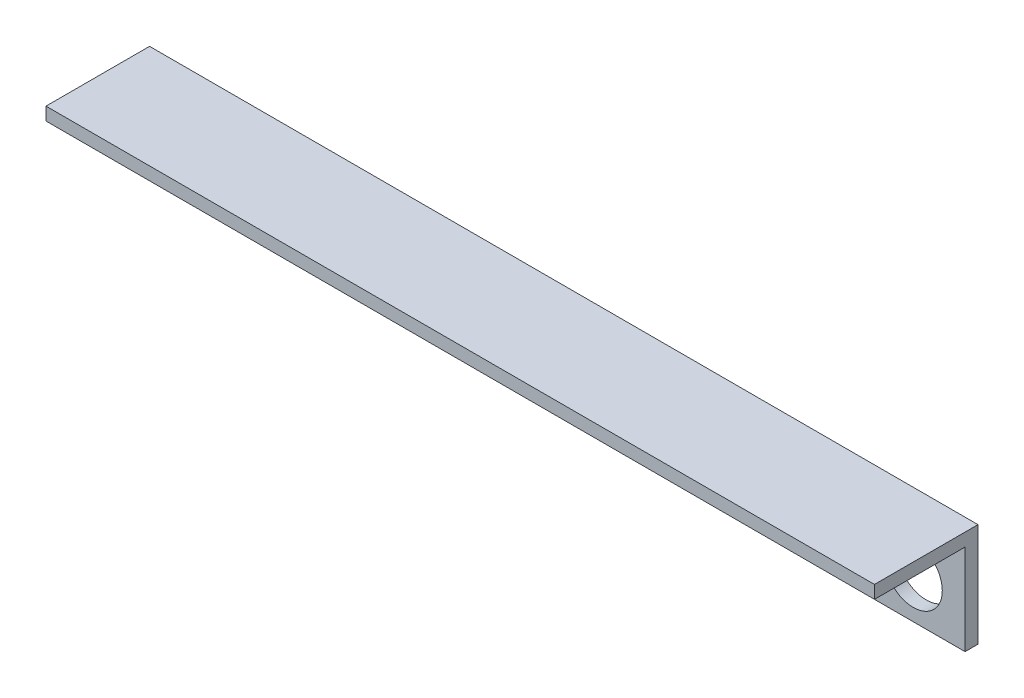
from build123d import *

# Parameters (mm, degrees)
BOSS_EXTRUDE1_DEPTH      = 57.15
BOSS_EXTRUDE1_DEPTH_BACK = 44.45
SKETCH3_R                = 3.556
CUT_EXTRUDE1_DEPTH       = 60.905780189


with BuildPart() as part:
    # Sketch1 → Boss-Extrude1 (new, two sides: drawn at the far end of the back side and taken through both)
    with BuildSketch(Plane(origin=(0, 0, 0), x_dir=(0, 0, -1), z_dir=(1, 0, 0)).offset(-BOSS_EXTRUDE1_DEPTH_BACK)):
        Polygon((0, 0), (0, 12.7), (-12.7, 12.7), (-12.7, 11.1125), (-1.5875, 11.1125), (-1.5875, 0), align=None)
    extrude(amount=BOSS_EXTRUDE1_DEPTH + BOSS_EXTRUDE1_DEPTH_BACK)

    # Sketch3 → Cut-Extrude1 (cut, through all)
    with BuildSketch(Plane(origin=(0, 0, 0), x_dir=(-1, 0, 0), z_dir=(0, 0, -1))):
        with Locations((25.4, 5.08)):
            Circle(SKETCH3_R)
        with Locations((-50.8, 5.08)):
            Circle(SKETCH3_R)
    extrude(amount=-CUT_EXTRUDE1_DEPTH, mode=Mode.SUBTRACT)


solid = part.part
